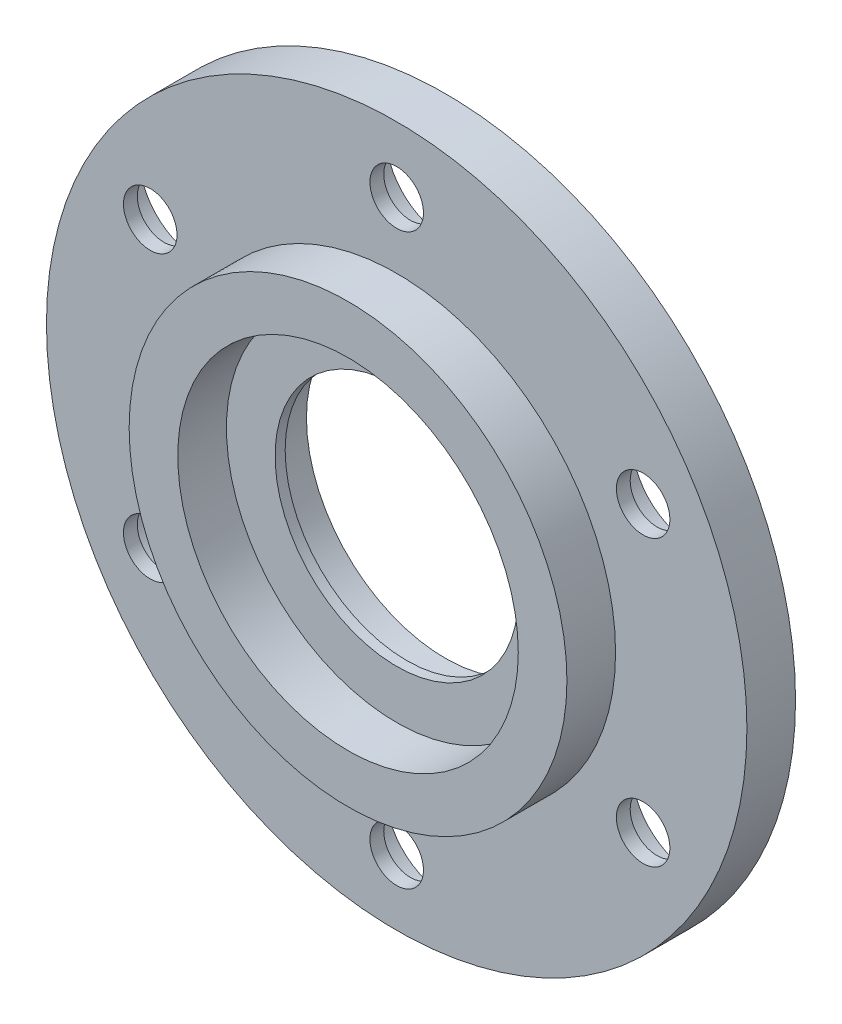
from build123d import *

# Parameters (mm, degrees)
SKETCH_CENTER_CUT_R                     = 12.5
CUT_CENTER_DEPTH                        = 52.15662225
CBORE_FOR_M5_HEX_HEAD_BOLT1_D           = 5.5
CBORE_FOR_M5_HEX_HEAD_BOLT1_CBORE_D     = 12.24
CBORE_FOR_M5_HEX_HEAD_BOLT1_CBORE_DEPTH = 3.58
CIRPATTERN1_COUNT                       = 6
SKETCH1_R                               = 14.2748
CUT_EXTRUDE1_DEPTH                      = 3.9624


with BuildPart() as part:
    # Sketch Spindle Skeleton → Main Revolve (revolve)
    with BuildSketch(Plane(origin=(0, 0, 0), x_dir=(0, 0, -1), z_dir=(1, 0, 0))):
        Polygon((-20.2, 17.5), (-20.2, 9.5), (-15.2, 9.5), (-15.2, 36), (-20.2, 36), (-20.2, 22.5), (-25.2, 22.5), (-25.2, 17.5), align=None)
    revolve(axis=Axis((0, 0, 1000), (0, 0, -1)))

    # Sketch Center Cut → Cut Center (cut, through all)
    with BuildSketch(Plane.XY.offset(20.2)):
        Circle(SKETCH_CENTER_CUT_R)
    extrude(amount=-CUT_CENTER_DEPTH, mode=Mode.SUBTRACT)

    # CBORE for M5 Hex Head Bolt1 (through all)
    with Locations(Plane(origin=(0, 0, 15.2), x_dir=(-1, 0, 0), z_dir=(0, 0, -1))):
        with Locations((0, 29.25)):
            cbore_for_m5_hex_head_bolt1 = CounterBoreHole(CBORE_FOR_M5_HEX_HEAD_BOLT1_D / 2, CBORE_FOR_M5_HEX_HEAD_BOLT1_CBORE_D / 2, CBORE_FOR_M5_HEX_HEAD_BOLT1_CBORE_DEPTH)

    # CirPattern1: CBORE for M5 Hex Head Bolt1 ×6 about axis
    cirpattern1_axis = Axis((0, 0, 15.2), (0, 0, 1))
    for i in range(1, CIRPATTERN1_COUNT):
        add(cbore_for_m5_hex_head_bolt1.rotate(cirpattern1_axis, i * 360 / CIRPATTERN1_COUNT), mode=Mode.SUBTRACT)

    # Sketch1 → Cut-Extrude1 (cut)
    with BuildSketch(Plane(origin=(0, 0, 15.2), x_dir=(-1, 0, 0), z_dir=(0, 0, -1))):
        Circle(SKETCH1_R)
    extrude(amount=-CUT_EXTRUDE1_DEPTH, mode=Mode.SUBTRACT)


solid = part.part
